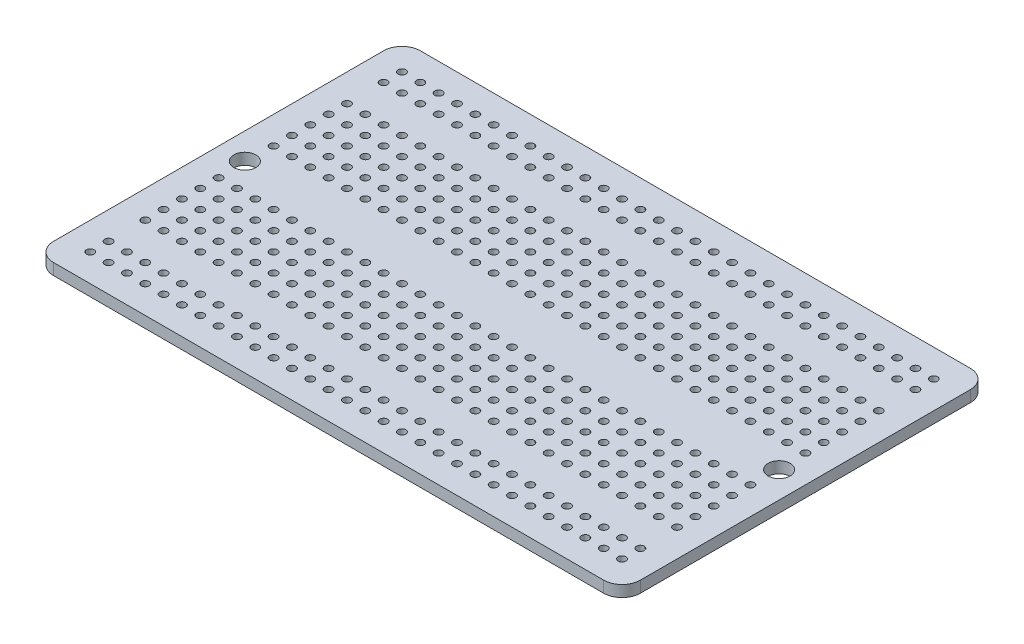
from build123d import *

# Parameters (mm, degrees)
SKETCH1_W           = 81.28
SKETCH1_H           = 50.8
BOSS_EXTRUDE1_DEPTH = 1.5748
SKETCH4_R           = 1.524
CUT_EXTRUDE2_DEPTH  = 2.54
FILLET1_R           = 2.54
SKETCH2_R           = 0.5334
CUT_EXTRUDE1_DEPTH  = 48.950491082
LPATTERN2_OUTLINE_R = 0.5334
LPATTERN2_DEPTH     = 1.5748


# Read off the part's stored shape, not the designer's step: LPattern2
with BuildPart() as part:
    # Sketch1 → Boss-Extrude1 (new body)
    with BuildSketch(Plane(origin=(0, 0, 0), x_dir=(1, 0, 0), z_dir=(0, 1, 0))):
        Rectangle(SKETCH1_W, SKETCH1_H)
    extrude(amount=BOSS_EXTRUDE1_DEPTH)

    # Sketch4 → Cut-Extrude2 (cut)
    with BuildSketch(Plane(origin=(0, 1.5748, 0), x_dir=(1, 0, 0), z_dir=(0, 1, 0))):
        with Locations(Location((37, 0, 0), (0, 0, 270))):
            Circle(SKETCH4_R)
        with Locations(Location((-37, 0, 0), (0, 0, 270))):
            Circle(SKETCH4_R)
    extrude(amount=-CUT_EXTRUDE2_DEPTH, mode=Mode.SUBTRACT)

    # Fillet1
    fillet1_edges = [part.edges().sort_by_distance(p)[0] for p in [
        (-40.64, 0.7874, -25.4),
        (40.64, 0.7874, -25.4),
        (40.64, 0.7874, 25.4),
        (-40.64, 0.7874, 25.4),
    ]]
    fillet(fillet1_edges, radius=FILLET1_R)

    # Sketch2 → Cut-Extrude1 (cut, through all)
    with BuildSketch(Plane(origin=(0, 1.5748, 0), x_dir=(1, 0, 0), z_dir=(0, 1, 0))):
        with Locations(Location((-36.83, 21.59, 0), (0, 0, 270))):
            Circle(SKETCH2_R)
    extrude(amount=-CUT_EXTRUDE1_DEPTH, mode=Mode.SUBTRACT)

    # LPattern2 outline → LPattern2 (cut)
    with BuildSketch(Plane(origin=(0, 0, 0), x_dir=(1, 0, 0), z_dir=(0, 1, 0))):
        with Locations((34.29, -19.05)):
            Circle(LPATTERN2_OUTLINE_R)
        with Locations((31.75, -19.05)):
            Circle(LPATTERN2_OUTLINE_R)
        with Locations((29.21, -19.05)):
            Circle(LPATTERN2_OUTLINE_R)
        with Locations((26.67, -19.05)):
            Circle(LPATTERN2_OUTLINE_R)
        with Locations((24.13, -19.05)):
            Circle(LPATTERN2_OUTLINE_R)
        with Locations((21.59, -19.05)):
            Circle(LPATTERN2_OUTLINE_R)
        with Locations((19.05, -19.05)):
            Circle(LPATTERN2_OUTLINE_R)
        with Locations((16.51, -19.05)):
            Circle(LPATTERN2_OUTLINE_R)
        with Locations((13.97, -19.05)):
            Circle(LPATTERN2_OUTLINE_R)
        with Locations((11.43, -19.05)):
            Circle(LPATTERN2_OUTLINE_R)
        with Locations((8.89, -19.05)):
            Circle(LPATTERN2_OUTLINE_R)
        with Locations((6.35, -19.05)):
            Circle(LPATTERN2_OUTLINE_R)
        with Locations((3.81, -19.05)):
            Circle(LPATTERN2_OUTLINE_R)
        with Locations((1.27, -19.05)):
            Circle(LPATTERN2_OUTLINE_R)
        with Locations((-1.27, -19.05)):
            Circle(LPATTERN2_OUTLINE_R)
        with Locations((-3.81, -19.05)):
            Circle(LPATTERN2_OUTLINE_R)
        with Locations((-6.35, -19.05)):
            Circle(LPATTERN2_OUTLINE_R)
        with Locations((-8.89, -19.05)):
            Circle(LPATTERN2_OUTLINE_R)
        with Locations((-11.43, -19.05)):
            Circle(LPATTERN2_OUTLINE_R)
        with Locations((-13.97, -19.05)):
            Circle(LPATTERN2_OUTLINE_R)
        with Locations((-16.51, -19.05)):
            Circle(LPATTERN2_OUTLINE_R)
        with Locations((-19.05, -19.05)):
            Circle(LPATTERN2_OUTLINE_R)
        with Locations((-21.59, -19.05)):
            Circle(LPATTERN2_OUTLINE_R)
        with Locations((-24.13, -19.05)):
            Circle(LPATTERN2_OUTLINE_R)
        with Locations((-26.67, -19.05)):
            Circle(LPATTERN2_OUTLINE_R)
        with Locations((-29.21, -19.05)):
            Circle(LPATTERN2_OUTLINE_R)
        with Locations((-31.75, -19.05)):
            Circle(LPATTERN2_OUTLINE_R)
        with Locations((-34.29, -19.05)):
            Circle(LPATTERN2_OUTLINE_R)
        with Locations((34.29, -13.97)):
            Circle(LPATTERN2_OUTLINE_R)
        with Locations((31.75, -13.97)):
            Circle(LPATTERN2_OUTLINE_R)
        with Locations((29.21, -13.97)):
            Circle(LPATTERN2_OUTLINE_R)
        with Locations((26.67, -13.97)):
            Circle(LPATTERN2_OUTLINE_R)
        with Locations((24.13, -13.97)):
            Circle(LPATTERN2_OUTLINE_R)
        with Locations((21.59, -13.97)):
            Circle(LPATTERN2_OUTLINE_R)
        with Locations((19.05, -13.97)):
            Circle(LPATTERN2_OUTLINE_R)
        with Locations((16.51, -13.97)):
            Circle(LPATTERN2_OUTLINE_R)
        with Locations((13.97, -13.97)):
            Circle(LPATTERN2_OUTLINE_R)
        with Locations((11.43, -13.97)):
            Circle(LPATTERN2_OUTLINE_R)
        with Locations((8.89, -13.97)):
            Circle(LPATTERN2_OUTLINE_R)
        with Locations((6.35, -13.97)):
            Circle(LPATTERN2_OUTLINE_R)
        with Locations((3.81, -13.97)):
            Circle(LPATTERN2_OUTLINE_R)
        with Locations((1.27, -13.97)):
            Circle(LPATTERN2_OUTLINE_R)
        with Locations((-1.27, -13.97)):
            Circle(LPATTERN2_OUTLINE_R)
        with Locations((-3.81, -13.97)):
            Circle(LPATTERN2_OUTLINE_R)
        with Locations((-6.35, -13.97)):
            Circle(LPATTERN2_OUTLINE_R)
        with Locations((-8.89, -13.97)):
            Circle(LPATTERN2_OUTLINE_R)
        with Locations((-11.43, -13.97)):
            Circle(LPATTERN2_OUTLINE_R)
        with Locations((-13.97, -13.97)):
            Circle(LPATTERN2_OUTLINE_R)
        with Locations((-16.51, -13.97)):
            Circle(LPATTERN2_OUTLINE_R)
        with Locations((-19.05, -13.97)):
            Circle(LPATTERN2_OUTLINE_R)
        with Locations((-21.59, -13.97)):
            Circle(LPATTERN2_OUTLINE_R)
        with Locations((-24.13, -13.97)):
            Circle(LPATTERN2_OUTLINE_R)
        with Locations((-26.67, -13.97)):
            Circle(LPATTERN2_OUTLINE_R)
        with Locations((-29.21, -13.97)):
            Circle(LPATTERN2_OUTLINE_R)
        with Locations((-31.75, -13.97)):
            Circle(LPATTERN2_OUTLINE_R)
        with Locations((-34.29, -13.97)):
            Circle(LPATTERN2_OUTLINE_R)
        with Locations((34.29, -11.43)):
            Circle(LPATTERN2_OUTLINE_R)
        with Locations((31.75, -11.43)):
            Circle(LPATTERN2_OUTLINE_R)
        with Locations((29.21, -11.43)):
            Circle(LPATTERN2_OUTLINE_R)
        with Locations((26.67, -11.43)):
            Circle(LPATTERN2_OUTLINE_R)
        with Locations((24.13, -11.43)):
            Circle(LPATTERN2_OUTLINE_R)
        with Locations((21.59, -11.43)):
            Circle(LPATTERN2_OUTLINE_R)
        with Locations((19.05, -11.43)):
            Circle(LPATTERN2_OUTLINE_R)
        with Locations((16.51, -11.43)):
            Circle(LPATTERN2_OUTLINE_R)
        with Locations((13.97, -11.43)):
            Circle(LPATTERN2_OUTLINE_R)
        with Locations((11.43, -11.43)):
            Circle(LPATTERN2_OUTLINE_R)
        with Locations((8.89, -11.43)):
            Circle(LPATTERN2_OUTLINE_R)
        with Locations((6.35, -11.43)):
            Circle(LPATTERN2_OUTLINE_R)
        with Locations((3.81, -11.43)):
            Circle(LPATTERN2_OUTLINE_R)
        with Locations((1.27, -11.43)):
            Circle(LPATTERN2_OUTLINE_R)
        with Locations((-1.27, -11.43)):
            Circle(LPATTERN2_OUTLINE_R)
        with Locations((-3.81, -11.43)):
            Circle(LPATTERN2_OUTLINE_R)
        with Locations((-6.35, -11.43)):
            Circle(LPATTERN2_OUTLINE_R)
        with Locations((-8.89, -11.43)):
            Circle(LPATTERN2_OUTLINE_R)
        with Locations((-11.43, -11.43)):
            Circle(LPATTERN2_OUTLINE_R)
        with Locations((-13.97, -11.43)):
            Circle(LPATTERN2_OUTLINE_R)
        with Locations((-16.51, -11.43)):
            Circle(LPATTERN2_OUTLINE_R)
        with Locations((-19.05, -11.43)):
            Circle(LPATTERN2_OUTLINE_R)
        with Locations((-21.59, -11.43)):
            Circle(LPATTERN2_OUTLINE_R)
        with Locations((-24.13, -11.43)):
            Circle(LPATTERN2_OUTLINE_R)
        with Locations((-26.67, -11.43)):
            Circle(LPATTERN2_OUTLINE_R)
        with Locations((-29.21, -11.43)):
            Circle(LPATTERN2_OUTLINE_R)
        with Locations((-31.75, -11.43)):
            Circle(LPATTERN2_OUTLINE_R)
        with Locations((-34.29, -11.43)):
            Circle(LPATTERN2_OUTLINE_R)
        with Locations((34.29, -8.89)):
            Circle(LPATTERN2_OUTLINE_R)
        with Locations((31.75, -8.89)):
            Circle(LPATTERN2_OUTLINE_R)
        with Locations((29.21, -8.89)):
            Circle(LPATTERN2_OUTLINE_R)
        with Locations((26.67, -8.89)):
            Circle(LPATTERN2_OUTLINE_R)
        with Locations((24.13, -8.89)):
            Circle(LPATTERN2_OUTLINE_R)
        with Locations((21.59, -8.89)):
            Circle(LPATTERN2_OUTLINE_R)
        with Locations((19.05, -8.89)):
            Circle(LPATTERN2_OUTLINE_R)
        with Locations((16.51, -8.89)):
            Circle(LPATTERN2_OUTLINE_R)
        with Locations((13.97, -8.89)):
            Circle(LPATTERN2_OUTLINE_R)
        with Locations((11.43, -8.89)):
            Circle(LPATTERN2_OUTLINE_R)
        with Locations((8.89, -8.89)):
            Circle(LPATTERN2_OUTLINE_R)
        with Locations((6.35, -8.89)):
            Circle(LPATTERN2_OUTLINE_R)
        with Locations((3.81, -8.89)):
            Circle(LPATTERN2_OUTLINE_R)
        with Locations((1.27, -8.89)):
            Circle(LPATTERN2_OUTLINE_R)
        with Locations((-1.27, -8.89)):
            Circle(LPATTERN2_OUTLINE_R)
        with Locations((-3.81, -8.89)):
            Circle(LPATTERN2_OUTLINE_R)
        with Locations((-6.35, -8.89)):
            Circle(LPATTERN2_OUTLINE_R)
        with Locations((-8.89, -8.89)):
            Circle(LPATTERN2_OUTLINE_R)
        with Locations((-11.43, -8.89)):
            Circle(LPATTERN2_OUTLINE_R)
        with Locations((-13.97, -8.89)):
            Circle(LPATTERN2_OUTLINE_R)
        with Locations((-16.51, -8.89)):
            Circle(LPATTERN2_OUTLINE_R)
        with Locations((-19.05, -8.89)):
            Circle(LPATTERN2_OUTLINE_R)
        with Locations((-21.59, -8.89)):
            Circle(LPATTERN2_OUTLINE_R)
        with Locations((-24.13, -8.89)):
            Circle(LPATTERN2_OUTLINE_R)
        with Locations((-26.67, -8.89)):
            Circle(LPATTERN2_OUTLINE_R)
        with Locations((-29.21, -8.89)):
            Circle(LPATTERN2_OUTLINE_R)
        with Locations((-31.75, -8.89)):
            Circle(LPATTERN2_OUTLINE_R)
        with Locations((-34.29, -8.89)):
            Circle(LPATTERN2_OUTLINE_R)
        with Locations((34.29, -6.35)):
            Circle(LPATTERN2_OUTLINE_R)
        with Locations((31.75, -6.35)):
            Circle(LPATTERN2_OUTLINE_R)
        with Locations((29.21, -6.35)):
            Circle(LPATTERN2_OUTLINE_R)
        with Locations((26.67, -6.35)):
            Circle(LPATTERN2_OUTLINE_R)
        with Locations((24.13, -6.35)):
            Circle(LPATTERN2_OUTLINE_R)
        with Locations((21.59, -6.35)):
            Circle(LPATTERN2_OUTLINE_R)
        with Locations((19.05, -6.35)):
            Circle(LPATTERN2_OUTLINE_R)
        with Locations((16.51, -6.35)):
            Circle(LPATTERN2_OUTLINE_R)
        with Locations((13.97, -6.35)):
            Circle(LPATTERN2_OUTLINE_R)
        with Locations((11.43, -6.35)):
            Circle(LPATTERN2_OUTLINE_R)
        with Locations((8.89, -6.35)):
            Circle(LPATTERN2_OUTLINE_R)
        with Locations((6.35, -6.35)):
            Circle(LPATTERN2_OUTLINE_R)
        with Locations((3.81, -6.35)):
            Circle(LPATTERN2_OUTLINE_R)
        with Locations((1.27, -6.35)):
            Circle(LPATTERN2_OUTLINE_R)
        with Locations((-1.27, -6.35)):
            Circle(LPATTERN2_OUTLINE_R)
        with Locations((-3.81, -6.35)):
            Circle(LPATTERN2_OUTLINE_R)
        with Locations((-6.35, -6.35)):
            Circle(LPATTERN2_OUTLINE_R)
        with Locations((-8.89, -6.35)):
            Circle(LPATTERN2_OUTLINE_R)
        with Locations((-11.43, -6.35)):
            Circle(LPATTERN2_OUTLINE_R)
        with Locations((-13.97, -6.35)):
            Circle(LPATTERN2_OUTLINE_R)
        with Locations((-16.51, -6.35)):
            Circle(LPATTERN2_OUTLINE_R)
        with Locations((-19.05, -6.35)):
            Circle(LPATTERN2_OUTLINE_R)
        with Locations((-21.59, -6.35)):
            Circle(LPATTERN2_OUTLINE_R)
        with Locations((-24.13, -6.35)):
            Circle(LPATTERN2_OUTLINE_R)
        with Locations((-26.67, -6.35)):
            Circle(LPATTERN2_OUTLINE_R)
        with Locations((-29.21, -6.35)):
            Circle(LPATTERN2_OUTLINE_R)
        with Locations((-31.75, -6.35)):
            Circle(LPATTERN2_OUTLINE_R)
        with Locations((-34.29, -6.35)):
            Circle(LPATTERN2_OUTLINE_R)
        with Locations((34.29, -3.81)):
            Circle(LPATTERN2_OUTLINE_R)
        with Locations((31.75, -3.81)):
            Circle(LPATTERN2_OUTLINE_R)
        with Locations((29.21, -3.81)):
            Circle(LPATTERN2_OUTLINE_R)
        with Locations((26.67, -3.81)):
            Circle(LPATTERN2_OUTLINE_R)
        with Locations((24.13, -3.81)):
            Circle(LPATTERN2_OUTLINE_R)
        with Locations((21.59, -3.81)):
            Circle(LPATTERN2_OUTLINE_R)
        with Locations((19.05, -3.81)):
            Circle(LPATTERN2_OUTLINE_R)
        with Locations((16.51, -3.81)):
            Circle(LPATTERN2_OUTLINE_R)
        with Locations((13.97, -3.81)):
            Circle(LPATTERN2_OUTLINE_R)
        with Locations((11.43, -3.81)):
            Circle(LPATTERN2_OUTLINE_R)
        with Locations((8.89, -3.81)):
            Circle(LPATTERN2_OUTLINE_R)
        with Locations((6.35, -3.81)):
            Circle(LPATTERN2_OUTLINE_R)
        with Locations((3.81, -3.81)):
            Circle(LPATTERN2_OUTLINE_R)
        with Locations((1.27, -3.81)):
            Circle(LPATTERN2_OUTLINE_R)
        with Locations((-1.27, -3.81)):
            Circle(LPATTERN2_OUTLINE_R)
        with Locations((-3.81, -3.81)):
            Circle(LPATTERN2_OUTLINE_R)
        with Locations((-6.35, -3.81)):
            Circle(LPATTERN2_OUTLINE_R)
        with Locations((-8.89, -3.81)):
            Circle(LPATTERN2_OUTLINE_R)
        with Locations((-11.43, -3.81)):
            Circle(LPATTERN2_OUTLINE_R)
        with Locations((-13.97, -3.81)):
            Circle(LPATTERN2_OUTLINE_R)
        with Locations((-16.51, -3.81)):
            Circle(LPATTERN2_OUTLINE_R)
        with Locations((-19.05, -3.81)):
            Circle(LPATTERN2_OUTLINE_R)
        with Locations((-21.59, -3.81)):
            Circle(LPATTERN2_OUTLINE_R)
        with Locations((-24.13, -3.81)):
            Circle(LPATTERN2_OUTLINE_R)
        with Locations((-26.67, -3.81)):
            Circle(LPATTERN2_OUTLINE_R)
        with Locations((-29.21, -3.81)):
            Circle(LPATTERN2_OUTLINE_R)
        with Locations((-31.75, -3.81)):
            Circle(LPATTERN2_OUTLINE_R)
        with Locations((-34.29, -3.81)):
            Circle(LPATTERN2_OUTLINE_R)
        with Locations((34.29, 3.81)):
            Circle(LPATTERN2_OUTLINE_R)
        with Locations((31.75, 3.81)):
            Circle(LPATTERN2_OUTLINE_R)
        with Locations((29.21, 3.81)):
            Circle(LPATTERN2_OUTLINE_R)
        with Locations((26.67, 3.81)):
            Circle(LPATTERN2_OUTLINE_R)
        with Locations((24.13, 3.81)):
            Circle(LPATTERN2_OUTLINE_R)
        with Locations((21.59, 3.81)):
            Circle(LPATTERN2_OUTLINE_R)
        with Locations((19.05, 3.81)):
            Circle(LPATTERN2_OUTLINE_R)
        with Locations((16.51, 3.81)):
            Circle(LPATTERN2_OUTLINE_R)
        with Locations((13.97, 3.81)):
            Circle(LPATTERN2_OUTLINE_R)
        with Locations((11.43, 3.81)):
            Circle(LPATTERN2_OUTLINE_R)
        with Locations((8.89, 3.81)):
            Circle(LPATTERN2_OUTLINE_R)
        with Locations((6.35, 3.81)):
            Circle(LPATTERN2_OUTLINE_R)
        with Locations((3.81, 3.81)):
            Circle(LPATTERN2_OUTLINE_R)
        with Locations((1.27, 3.81)):
            Circle(LPATTERN2_OUTLINE_R)
        with Locations((-1.27, 3.81)):
            Circle(LPATTERN2_OUTLINE_R)
        with Locations((-3.81, 3.81)):
            Circle(LPATTERN2_OUTLINE_R)
        with Locations((-6.35, 3.81)):
            Circle(LPATTERN2_OUTLINE_R)
        with Locations((-8.89, 3.81)):
            Circle(LPATTERN2_OUTLINE_R)
        with Locations((-11.43, 3.81)):
            Circle(LPATTERN2_OUTLINE_R)
        with Locations((-13.97, 3.81)):
            Circle(LPATTERN2_OUTLINE_R)
        with Locations((-16.51, 3.81)):
            Circle(LPATTERN2_OUTLINE_R)
        with Locations((-19.05, 3.81)):
            Circle(LPATTERN2_OUTLINE_R)
        with Locations((-21.59, 3.81)):
            Circle(LPATTERN2_OUTLINE_R)
        with Locations((-24.13, 3.81)):
            Circle(LPATTERN2_OUTLINE_R)
        with Locations((-26.67, 3.81)):
            Circle(LPATTERN2_OUTLINE_R)
        with Locations((-29.21, 3.81)):
            Circle(LPATTERN2_OUTLINE_R)
        with Locations((-31.75, 3.81)):
            Circle(LPATTERN2_OUTLINE_R)
        with Locations((-34.29, 3.81)):
            Circle(LPATTERN2_OUTLINE_R)
        with Locations((34.29, 6.35)):
            Circle(LPATTERN2_OUTLINE_R)
        with Locations((31.75, 6.35)):
            Circle(LPATTERN2_OUTLINE_R)
        with Locations((29.21, 6.35)):
            Circle(LPATTERN2_OUTLINE_R)
        with Locations((26.67, 6.35)):
            Circle(LPATTERN2_OUTLINE_R)
        with Locations((24.13, 6.35)):
            Circle(LPATTERN2_OUTLINE_R)
        with Locations((21.59, 6.35)):
            Circle(LPATTERN2_OUTLINE_R)
        with Locations((19.05, 6.35)):
            Circle(LPATTERN2_OUTLINE_R)
        with Locations((16.51, 6.35)):
            Circle(LPATTERN2_OUTLINE_R)
        with Locations((13.97, 6.35)):
            Circle(LPATTERN2_OUTLINE_R)
        with Locations((11.43, 6.35)):
            Circle(LPATTERN2_OUTLINE_R)
        with Locations((8.89, 6.35)):
            Circle(LPATTERN2_OUTLINE_R)
        with Locations((6.35, 6.35)):
            Circle(LPATTERN2_OUTLINE_R)
        with Locations((3.81, 6.35)):
            Circle(LPATTERN2_OUTLINE_R)
        with Locations((1.27, 6.35)):
            Circle(LPATTERN2_OUTLINE_R)
        with Locations((-1.27, 6.35)):
            Circle(LPATTERN2_OUTLINE_R)
        with Locations((-3.81, 6.35)):
            Circle(LPATTERN2_OUTLINE_R)
        with Locations((-6.35, 6.35)):
            Circle(LPATTERN2_OUTLINE_R)
        with Locations((-8.89, 6.35)):
            Circle(LPATTERN2_OUTLINE_R)
        with Locations((-11.43, 6.35)):
            Circle(LPATTERN2_OUTLINE_R)
        with Locations((-13.97, 6.35)):
            Circle(LPATTERN2_OUTLINE_R)
        with Locations((-16.51, 6.35)):
            Circle(LPATTERN2_OUTLINE_R)
        with Locations((-19.05, 6.35)):
            Circle(LPATTERN2_OUTLINE_R)
        with Locations((-21.59, 6.35)):
            Circle(LPATTERN2_OUTLINE_R)
        with Locations((-24.13, 6.35)):
            Circle(LPATTERN2_OUTLINE_R)
        with Locations((-26.67, 6.35)):
            Circle(LPATTERN2_OUTLINE_R)
        with Locations((-29.21, 6.35)):
            Circle(LPATTERN2_OUTLINE_R)
        with Locations((-31.75, 6.35)):
            Circle(LPATTERN2_OUTLINE_R)
        with Locations((-34.29, 6.35)):
            Circle(LPATTERN2_OUTLINE_R)
        with Locations((34.29, 8.89)):
            Circle(LPATTERN2_OUTLINE_R)
        with Locations((31.75, 8.89)):
            Circle(LPATTERN2_OUTLINE_R)
        with Locations((29.21, 8.89)):
            Circle(LPATTERN2_OUTLINE_R)
        with Locations((26.67, 8.89)):
            Circle(LPATTERN2_OUTLINE_R)
        with Locations((24.13, 8.89)):
            Circle(LPATTERN2_OUTLINE_R)
        with Locations((21.59, 8.89)):
            Circle(LPATTERN2_OUTLINE_R)
        with Locations((19.05, 8.89)):
            Circle(LPATTERN2_OUTLINE_R)
        with Locations((16.51, 8.89)):
            Circle(LPATTERN2_OUTLINE_R)
        with Locations((13.97, 8.89)):
            Circle(LPATTERN2_OUTLINE_R)
        with Locations((11.43, 8.89)):
            Circle(LPATTERN2_OUTLINE_R)
        with Locations((8.89, 8.89)):
            Circle(LPATTERN2_OUTLINE_R)
        with Locations((6.35, 8.89)):
            Circle(LPATTERN2_OUTLINE_R)
        with Locations((3.81, 8.89)):
            Circle(LPATTERN2_OUTLINE_R)
        with Locations((1.27, 8.89)):
            Circle(LPATTERN2_OUTLINE_R)
        with Locations((-1.27, 8.89)):
            Circle(LPATTERN2_OUTLINE_R)
        with Locations((-3.81, 8.89)):
            Circle(LPATTERN2_OUTLINE_R)
        with Locations((-6.35, 8.89)):
            Circle(LPATTERN2_OUTLINE_R)
        with Locations((-8.89, 8.89)):
            Circle(LPATTERN2_OUTLINE_R)
        with Locations((-11.43, 8.89)):
            Circle(LPATTERN2_OUTLINE_R)
        with Locations((-13.97, 8.89)):
            Circle(LPATTERN2_OUTLINE_R)
        with Locations((-16.51, 8.89)):
            Circle(LPATTERN2_OUTLINE_R)
        with Locations((-19.05, 8.89)):
            Circle(LPATTERN2_OUTLINE_R)
        with Locations((-21.59, 8.89)):
            Circle(LPATTERN2_OUTLINE_R)
        with Locations((-24.13, 8.89)):
            Circle(LPATTERN2_OUTLINE_R)
        with Locations((-26.67, 8.89)):
            Circle(LPATTERN2_OUTLINE_R)
        with Locations((-29.21, 8.89)):
            Circle(LPATTERN2_OUTLINE_R)
        with Locations((-31.75, 8.89)):
            Circle(LPATTERN2_OUTLINE_R)
        with Locations((-34.29, 8.89)):
            Circle(LPATTERN2_OUTLINE_R)
        with Locations((34.29, 11.43)):
            Circle(LPATTERN2_OUTLINE_R)
        with Locations((31.75, 11.43)):
            Circle(LPATTERN2_OUTLINE_R)
        with Locations((29.21, 11.43)):
            Circle(LPATTERN2_OUTLINE_R)
        with Locations((26.67, 11.43)):
            Circle(LPATTERN2_OUTLINE_R)
        with Locations((24.13, 11.43)):
            Circle(LPATTERN2_OUTLINE_R)
        with Locations((21.59, 11.43)):
            Circle(LPATTERN2_OUTLINE_R)
        with Locations((19.05, 11.43)):
            Circle(LPATTERN2_OUTLINE_R)
        with Locations((16.51, 11.43)):
            Circle(LPATTERN2_OUTLINE_R)
        with Locations((13.97, 11.43)):
            Circle(LPATTERN2_OUTLINE_R)
        with Locations((11.43, 11.43)):
            Circle(LPATTERN2_OUTLINE_R)
        with Locations((8.89, 11.43)):
            Circle(LPATTERN2_OUTLINE_R)
        with Locations((6.35, 11.43)):
            Circle(LPATTERN2_OUTLINE_R)
        with Locations((3.81, 11.43)):
            Circle(LPATTERN2_OUTLINE_R)
        with Locations((1.27, 11.43)):
            Circle(LPATTERN2_OUTLINE_R)
        with Locations((-1.27, 11.43)):
            Circle(LPATTERN2_OUTLINE_R)
        with Locations((-3.81, 11.43)):
            Circle(LPATTERN2_OUTLINE_R)
        with Locations((-6.35, 11.43)):
            Circle(LPATTERN2_OUTLINE_R)
        with Locations((-8.89, 11.43)):
            Circle(LPATTERN2_OUTLINE_R)
        with Locations((-11.43, 11.43)):
            Circle(LPATTERN2_OUTLINE_R)
        with Locations((-13.97, 11.43)):
            Circle(LPATTERN2_OUTLINE_R)
        with Locations((-16.51, 11.43)):
            Circle(LPATTERN2_OUTLINE_R)
        with Locations((-19.05, 11.43)):
            Circle(LPATTERN2_OUTLINE_R)
        with Locations((-21.59, 11.43)):
            Circle(LPATTERN2_OUTLINE_R)
        with Locations((-24.13, 11.43)):
            Circle(LPATTERN2_OUTLINE_R)
        with Locations((-26.67, 11.43)):
            Circle(LPATTERN2_OUTLINE_R)
        with Locations((-29.21, 11.43)):
            Circle(LPATTERN2_OUTLINE_R)
        with Locations((-31.75, 11.43)):
            Circle(LPATTERN2_OUTLINE_R)
        with Locations((-34.29, 11.43)):
            Circle(LPATTERN2_OUTLINE_R)
        with Locations((34.29, 13.97)):
            Circle(LPATTERN2_OUTLINE_R)
        with Locations((31.75, 13.97)):
            Circle(LPATTERN2_OUTLINE_R)
        with Locations((29.21, 13.97)):
            Circle(LPATTERN2_OUTLINE_R)
        with Locations((26.67, 13.97)):
            Circle(LPATTERN2_OUTLINE_R)
        with Locations((24.13, 13.97)):
            Circle(LPATTERN2_OUTLINE_R)
        with Locations((21.59, 13.97)):
            Circle(LPATTERN2_OUTLINE_R)
        with Locations((19.05, 13.97)):
            Circle(LPATTERN2_OUTLINE_R)
        with Locations((16.51, 13.97)):
            Circle(LPATTERN2_OUTLINE_R)
        with Locations((13.97, 13.97)):
            Circle(LPATTERN2_OUTLINE_R)
        with Locations((11.43, 13.97)):
            Circle(LPATTERN2_OUTLINE_R)
        with Locations((8.89, 13.97)):
            Circle(LPATTERN2_OUTLINE_R)
        with Locations((6.35, 13.97)):
            Circle(LPATTERN2_OUTLINE_R)
        with Locations((3.81, 13.97)):
            Circle(LPATTERN2_OUTLINE_R)
        with Locations((1.27, 13.97)):
            Circle(LPATTERN2_OUTLINE_R)
        with Locations((-1.27, 13.97)):
            Circle(LPATTERN2_OUTLINE_R)
        with Locations((-3.81, 13.97)):
            Circle(LPATTERN2_OUTLINE_R)
        with Locations((-6.35, 13.97)):
            Circle(LPATTERN2_OUTLINE_R)
        with Locations((-8.89, 13.97)):
            Circle(LPATTERN2_OUTLINE_R)
        with Locations((-11.43, 13.97)):
            Circle(LPATTERN2_OUTLINE_R)
        with Locations((-13.97, 13.97)):
            Circle(LPATTERN2_OUTLINE_R)
        with Locations((-16.51, 13.97)):
            Circle(LPATTERN2_OUTLINE_R)
        with Locations((-19.05, 13.97)):
            Circle(LPATTERN2_OUTLINE_R)
        with Locations((-21.59, 13.97)):
            Circle(LPATTERN2_OUTLINE_R)
        with Locations((-24.13, 13.97)):
            Circle(LPATTERN2_OUTLINE_R)
        with Locations((-26.67, 13.97)):
            Circle(LPATTERN2_OUTLINE_R)
        with Locations((-29.21, 13.97)):
            Circle(LPATTERN2_OUTLINE_R)
        with Locations((-31.75, 13.97)):
            Circle(LPATTERN2_OUTLINE_R)
        with Locations((-34.29, 13.97)):
            Circle(LPATTERN2_OUTLINE_R)
        with Locations((34.29, 19.05)):
            Circle(LPATTERN2_OUTLINE_R)
        with Locations((31.75, 19.05)):
            Circle(LPATTERN2_OUTLINE_R)
        with Locations((29.21, 19.05)):
            Circle(LPATTERN2_OUTLINE_R)
        with Locations((26.67, 19.05)):
            Circle(LPATTERN2_OUTLINE_R)
        with Locations((24.13, 19.05)):
            Circle(LPATTERN2_OUTLINE_R)
        with Locations((21.59, 19.05)):
            Circle(LPATTERN2_OUTLINE_R)
        with Locations((19.05, 19.05)):
            Circle(LPATTERN2_OUTLINE_R)
        with Locations((16.51, 19.05)):
            Circle(LPATTERN2_OUTLINE_R)
        with Locations((13.97, 19.05)):
            Circle(LPATTERN2_OUTLINE_R)
        with Locations((11.43, 19.05)):
            Circle(LPATTERN2_OUTLINE_R)
        with Locations((8.89, 19.05)):
            Circle(LPATTERN2_OUTLINE_R)
        with Locations((6.35, 19.05)):
            Circle(LPATTERN2_OUTLINE_R)
        with Locations((3.81, 19.05)):
            Circle(LPATTERN2_OUTLINE_R)
        with Locations((1.27, 19.05)):
            Circle(LPATTERN2_OUTLINE_R)
        with Locations((-1.27, 19.05)):
            Circle(LPATTERN2_OUTLINE_R)
        with Locations((-3.81, 19.05)):
            Circle(LPATTERN2_OUTLINE_R)
        with Locations((-6.35, 19.05)):
            Circle(LPATTERN2_OUTLINE_R)
        with Locations((-8.89, 19.05)):
            Circle(LPATTERN2_OUTLINE_R)
        with Locations((-11.43, 19.05)):
            Circle(LPATTERN2_OUTLINE_R)
        with Locations((-13.97, 19.05)):
            Circle(LPATTERN2_OUTLINE_R)
        with Locations((-16.51, 19.05)):
            Circle(LPATTERN2_OUTLINE_R)
        with Locations((-19.05, 19.05)):
            Circle(LPATTERN2_OUTLINE_R)
        with Locations((-21.59, 19.05)):
            Circle(LPATTERN2_OUTLINE_R)
        with Locations((-24.13, 19.05)):
            Circle(LPATTERN2_OUTLINE_R)
        with Locations((-26.67, 19.05)):
            Circle(LPATTERN2_OUTLINE_R)
        with Locations((-29.21, 19.05)):
            Circle(LPATTERN2_OUTLINE_R)
        with Locations((-31.75, 19.05)):
            Circle(LPATTERN2_OUTLINE_R)
        with Locations((-34.29, 19.05)):
            Circle(LPATTERN2_OUTLINE_R)
        with Locations((-36.83, 19.05)):
            Circle(LPATTERN2_OUTLINE_R)
        with Locations((-31.75, -21.59)):
            Circle(LPATTERN2_OUTLINE_R)
        with Locations((-31.75, 21.59)):
            Circle(LPATTERN2_OUTLINE_R)
        with Locations((-34.29, -21.59)):
            Circle(LPATTERN2_OUTLINE_R)
        with Locations((-34.29, 21.59)):
            Circle(LPATTERN2_OUTLINE_R)
        with Locations((-36.83, -21.59)):
            Circle(LPATTERN2_OUTLINE_R)
        with Locations((-36.83, -19.05)):
            Circle(LPATTERN2_OUTLINE_R)
        with Locations((-36.83, -13.97)):
            Circle(LPATTERN2_OUTLINE_R)
        with Locations((-36.83, -11.43)):
            Circle(LPATTERN2_OUTLINE_R)
        with Locations((-36.83, -8.89)):
            Circle(LPATTERN2_OUTLINE_R)
        with Locations((-36.83, -6.35)):
            Circle(LPATTERN2_OUTLINE_R)
        with Locations((-36.83, -3.81)):
            Circle(LPATTERN2_OUTLINE_R)
        with Locations((-36.83, 3.81)):
            Circle(LPATTERN2_OUTLINE_R)
        with Locations((-36.83, 6.35)):
            Circle(LPATTERN2_OUTLINE_R)
        with Locations((-36.83, 8.89)):
            Circle(LPATTERN2_OUTLINE_R)
        with Locations((-36.83, 11.43)):
            Circle(LPATTERN2_OUTLINE_R)
        with Locations((-36.83, 13.97)):
            Circle(LPATTERN2_OUTLINE_R)
        with Locations((-29.21, 21.59)):
            Circle(LPATTERN2_OUTLINE_R)
        with Locations((-29.21, -21.59)):
            Circle(LPATTERN2_OUTLINE_R)
        with Locations((-26.67, 21.59)):
            Circle(LPATTERN2_OUTLINE_R)
        with Locations((-26.67, -21.59)):
            Circle(LPATTERN2_OUTLINE_R)
        with Locations((-24.13, 21.59)):
            Circle(LPATTERN2_OUTLINE_R)
        with Locations((-24.13, -21.59)):
            Circle(LPATTERN2_OUTLINE_R)
        with Locations((-21.59, 21.59)):
            Circle(LPATTERN2_OUTLINE_R)
        with Locations((-21.59, -21.59)):
            Circle(LPATTERN2_OUTLINE_R)
        with Locations((-19.05, 21.59)):
            Circle(LPATTERN2_OUTLINE_R)
        with Locations((-19.05, -21.59)):
            Circle(LPATTERN2_OUTLINE_R)
        with Locations((-16.51, 21.59)):
            Circle(LPATTERN2_OUTLINE_R)
        with Locations((-16.51, -21.59)):
            Circle(LPATTERN2_OUTLINE_R)
        with Locations((-13.97, 21.59)):
            Circle(LPATTERN2_OUTLINE_R)
        with Locations((-13.97, -21.59)):
            Circle(LPATTERN2_OUTLINE_R)
        with Locations((-11.43, 21.59)):
            Circle(LPATTERN2_OUTLINE_R)
        with Locations((-11.43, -21.59)):
            Circle(LPATTERN2_OUTLINE_R)
        with Locations((-8.89, 21.59)):
            Circle(LPATTERN2_OUTLINE_R)
        with Locations((-8.89, -21.59)):
            Circle(LPATTERN2_OUTLINE_R)
        with Locations((-6.35, 21.59)):
            Circle(LPATTERN2_OUTLINE_R)
        with Locations((-6.35, -21.59)):
            Circle(LPATTERN2_OUTLINE_R)
        with Locations((-3.81, 21.59)):
            Circle(LPATTERN2_OUTLINE_R)
        with Locations((-3.81, -21.59)):
            Circle(LPATTERN2_OUTLINE_R)
        with Locations((-1.27, 21.59)):
            Circle(LPATTERN2_OUTLINE_R)
        with Locations((-1.27, -21.59)):
            Circle(LPATTERN2_OUTLINE_R)
        with Locations((1.27, 21.59)):
            Circle(LPATTERN2_OUTLINE_R)
        with Locations((1.27, -21.59)):
            Circle(LPATTERN2_OUTLINE_R)
        with Locations((3.81, 21.59)):
            Circle(LPATTERN2_OUTLINE_R)
        with Locations((3.81, -21.59)):
            Circle(LPATTERN2_OUTLINE_R)
        with Locations((6.35, 21.59)):
            Circle(LPATTERN2_OUTLINE_R)
        with Locations((6.35, -21.59)):
            Circle(LPATTERN2_OUTLINE_R)
        with Locations((8.89, 21.59)):
            Circle(LPATTERN2_OUTLINE_R)
        with Locations((8.89, -21.59)):
            Circle(LPATTERN2_OUTLINE_R)
        with Locations((11.43, 21.59)):
            Circle(LPATTERN2_OUTLINE_R)
        with Locations((11.43, -21.59)):
            Circle(LPATTERN2_OUTLINE_R)
        with Locations((13.97, 21.59)):
            Circle(LPATTERN2_OUTLINE_R)
        with Locations((13.97, -21.59)):
            Circle(LPATTERN2_OUTLINE_R)
        with Locations((16.51, 21.59)):
            Circle(LPATTERN2_OUTLINE_R)
        with Locations((16.51, -21.59)):
            Circle(LPATTERN2_OUTLINE_R)
        with Locations((19.05, 21.59)):
            Circle(LPATTERN2_OUTLINE_R)
        with Locations((19.05, -21.59)):
            Circle(LPATTERN2_OUTLINE_R)
        with Locations((21.59, 21.59)):
            Circle(LPATTERN2_OUTLINE_R)
        with Locations((21.59, -21.59)):
            Circle(LPATTERN2_OUTLINE_R)
        with Locations((24.13, 21.59)):
            Circle(LPATTERN2_OUTLINE_R)
        with Locations((24.13, -21.59)):
            Circle(LPATTERN2_OUTLINE_R)
        with Locations((26.67, 21.59)):
            Circle(LPATTERN2_OUTLINE_R)
        with Locations((26.67, -21.59)):
            Circle(LPATTERN2_OUTLINE_R)
        with Locations((29.21, 21.59)):
            Circle(LPATTERN2_OUTLINE_R)
        with Locations((29.21, -21.59)):
            Circle(LPATTERN2_OUTLINE_R)
        with Locations((36.83, -21.59)):
            Circle(LPATTERN2_OUTLINE_R)
        with Locations((36.83, -19.05)):
            Circle(LPATTERN2_OUTLINE_R)
        with Locations((31.75, 21.59)):
            Circle(LPATTERN2_OUTLINE_R)
        with Locations((31.75, -21.59)):
            Circle(LPATTERN2_OUTLINE_R)
        with Locations((34.29, 21.59)):
            Circle(LPATTERN2_OUTLINE_R)
        with Locations((34.29, -21.59)):
            Circle(LPATTERN2_OUTLINE_R)
        with Locations((36.83, 21.59)):
            Circle(LPATTERN2_OUTLINE_R)
        with Locations((36.83, 19.05)):
            Circle(LPATTERN2_OUTLINE_R)
        with Locations((36.83, 13.97)):
            Circle(LPATTERN2_OUTLINE_R)
        with Locations((36.83, 11.43)):
            Circle(LPATTERN2_OUTLINE_R)
        with Locations((36.83, 8.89)):
            Circle(LPATTERN2_OUTLINE_R)
        with Locations((36.83, 6.35)):
            Circle(LPATTERN2_OUTLINE_R)
        with Locations((36.83, 3.81)):
            Circle(LPATTERN2_OUTLINE_R)
        with Locations((36.83, -3.81)):
            Circle(LPATTERN2_OUTLINE_R)
        with Locations((36.83, -6.35)):
            Circle(LPATTERN2_OUTLINE_R)
        with Locations((36.83, -8.89)):
            Circle(LPATTERN2_OUTLINE_R)
        with Locations((36.83, -11.43)):
            Circle(LPATTERN2_OUTLINE_R)
        with Locations((36.83, -13.97)):
            Circle(LPATTERN2_OUTLINE_R)
    extrude(amount=LPATTERN2_DEPTH, mode=Mode.SUBTRACT)


solid = part.part
